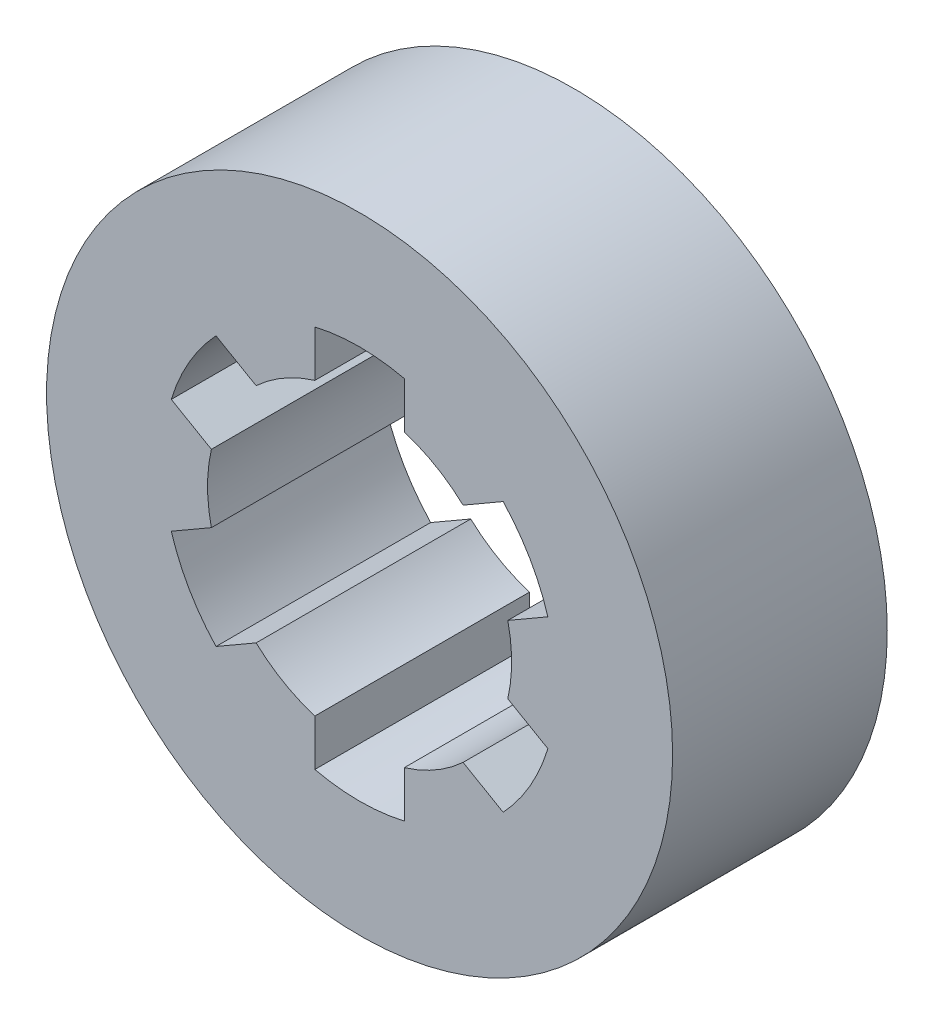
from build123d import *

# Parameters (mm, degrees)
SKETCH1_R           = 17.5
BOSS_EXTRUDE1_DEPTH = 12


with BuildPart() as part:
    # Sketch1 → Boss-Extrude1 (new body)
    with BuildSketch(Plane.XY):
        Circle(SKETCH1_R)
        with BuildLine():
            Line((-2.5, 8.124038405), (-2.5, 10.712142643))
            ThreePointArc((-2.5, 10.712142643), (0, 11), (2.5, 10.712142643))
            Line((2.5, 10.712142643), (2.5, 8.124038405))
            ThreePointArc((2.5, 8.124038405), (4.25, 7.361215932), (5.78562364, 6.227082712))
            Line((5.78562364, 6.227082712), (8.026987658, 7.521134831))
            ThreePointArc((8.026987658, 7.521134831), (9.526279442, 5.5), (10.526987658, 3.191007812))
            Line((10.526987658, 3.191007812), (8.28562364, 1.896955693))
            ThreePointArc((8.28562364, 1.896955693), (8.5, 0), (8.28562364, -1.896955693))
            Line((8.28562364, -1.896955693), (10.526987658, -3.191007812))
            ThreePointArc((10.526987658, -3.191007812), (9.526279442, -5.5), (8.026987658, -7.521134831))
            Line((8.026987658, -7.521134831), (5.78562364, -6.227082712))
            ThreePointArc((5.78562364, -6.227082712), (4.25, -7.361215932), (2.5, -8.124038405))
            Line((2.5, -8.124038405), (2.5, -10.712142643))
            ThreePointArc((2.5, -10.712142643), (0, -11), (-2.5, -10.712142643))
            Line((-2.5, -10.712142643), (-2.5, -8.124038405))
            ThreePointArc((-2.5, -8.124038405), (-4.25, -7.361215932), (-5.78562364, -6.227082712))
            Line((-5.78562364, -6.227082712), (-8.026987658, -7.521134831))
            ThreePointArc((-8.026987658, -7.521134831), (-9.526279442, -5.5), (-10.526987658, -3.191007812))
            Line((-10.526987658, -3.191007812), (-8.28562364, -1.896955693))
            ThreePointArc((-8.28562364, -1.896955693), (-8.5, 0), (-8.28562364, 1.896955693))
            Line((-8.28562364, 1.896955693), (-10.526987658, 3.191007812))
            ThreePointArc((-10.526987658, 3.191007812), (-9.526279442, 5.5), (-8.026987658, 7.521134831))
            Line((-8.026987658, 7.521134831), (-5.78562364, 6.227082712))
            ThreePointArc((-5.78562364, 6.227082712), (-4.25, 7.361215932), (-2.5, 8.124038405))
        make_face(mode=Mode.SUBTRACT)
    extrude(amount=BOSS_EXTRUDE1_DEPTH)


solid = part.part
